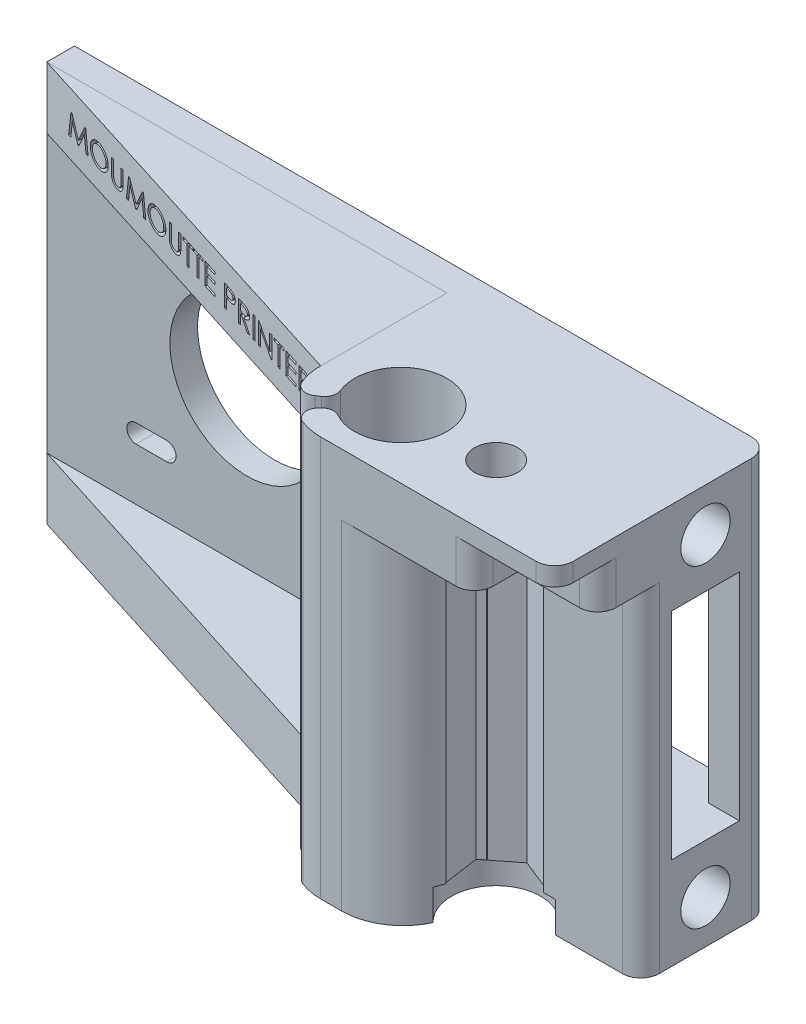
from build123d import *

# Parameters (mm, degrees)
SKETCH1_W           = 48
SKETCH1_H           = 35
BOSS_EXTRUDE1_DEPTH = 65
SKETCH2_R           = 7.5
SKETCH2_R_2         = 3.5
CUT_EXTRUDE1_DEPTH  = 89.056799851
SKETCH3_W           = 14
SKETCH3_H           = 55
CUT_EXTRUDE2_DEPTH  = 25
SKETCH4_W           = 11
SKETCH4_H           = 35
CUT_EXTRUDE3_DEPTH  = 89.056799851
SKETCH7_R           = 4
CUT_EXTRUDE4_DEPTH  = 28.5
SKETCH8_W           = 38
SKETCH8_H           = 35
CUT_EXTRUDE5_DEPTH  = 10
SKETCH9_W           = 7
SKETCH9_H           = 7
CUT_EXTRUDE7_DEPTH  = 13
FILLET2_R           = 3
CUT_EXTRUDE8_DEPTH  = 60
SKETCH11_R          = 7.25
CUT_EXTRUDE9_DEPTH  = 5
FILLET3_R           = 10
CUT_EXTRUDE11_DEPTH = 89.056799851
FILLET4_R           = 2
SKETCH14_W          = 65
SKETCH14_H          = 65
BOSS_EXTRUDE2_DEPTH = 4.5
BOSS_EXTRUDE3_DEPTH = 10
BOSS_EXTRUDE4_DEPTH = 10
SKETCH17_R          = 12.5
CUT_EXTRUDE12_DEPTH = 97.851690744
SKETCH18_W          = 0.538461539
SKETCH18_H          = 3.5
CUT_EXTRUDE13_DEPTH = 2


with BuildPart() as part:
    # Sketch1 → Boss-Extrude1 (new body)
    with BuildSketch(Plane(origin=(0, 0, 0), x_dir=(1, 0, 0), z_dir=(0, 1, 0))):
        with Locations((24, 17.5)):
            Rectangle(SKETCH1_W, SKETCH1_H)
    extrude(amount=BOSS_EXTRUDE1_DEPTH)

    # Sketch2 → Cut-Extrude1 (cut, through all)
    with BuildSketch(Plane(origin=(0, 65, 0), x_dir=(1, 0, 0), z_dir=(0, 1, 0))):
        with Locations(Location((12, 11, 0), (0, 0, 270))):
            Circle(SKETCH2_R)
        with Locations(Location((27.5, 11, 0), (0, 0, 270))):
            Circle(SKETCH2_R_2)
    extrude(amount=-CUT_EXTRUDE1_DEPTH, mode=Mode.SUBTRACT)

    # Sketch3 → Cut-Extrude2 (cut)
    with BuildSketch(Plane(origin=(48, 0, 0), x_dir=(0, 0, -1), z_dir=(1, 0, 0))):
        with Locations((7, 27.5)):
            Rectangle(SKETCH3_W, SKETCH3_H)
    extrude(amount=-CUT_EXTRUDE2_DEPTH, mode=Mode.SUBTRACT)

    # Sketch4 → Cut-Extrude3 (cut, through all)
    with BuildSketch(Plane(origin=(48, 0, 0), x_dir=(0, 0, -1), z_dir=(1, 0, 0))):
        with Locations((24.5, 32.5)):
            Rectangle(SKETCH4_W, SKETCH4_H)
    extrude(amount=-CUT_EXTRUDE3_DEPTH, mode=Mode.SUBTRACT)

    # Sketch7 → Cut-Extrude4 (cut)
    with BuildSketch(Plane(origin=(48, 0, 0), x_dir=(0, 0, -1), z_dir=(1, 0, 0))):
        with Locations((24.5, 58)):
            Circle(SKETCH7_R)
        with Locations((24.5, 7)):
            Circle(SKETCH7_R)
    extrude(amount=-CUT_EXTRUDE4_DEPTH, mode=Mode.SUBTRACT)

    # Sketch8 → Cut-Extrude5 (cut)
    with BuildSketch(Plane(origin=(0, 0, -35), x_dir=(-1, 0, 0), z_dir=(0, 0, -1))):
        with Locations((-24, 32.5)):
            Rectangle(SKETCH8_W, SKETCH8_H)
    extrude(amount=-CUT_EXTRUDE5_DEPTH, mode=Mode.SUBTRACT)

    # Sketch9 → Cut-Extrude7 (cut)
    with BuildSketch(Plane(origin=(48, 0, 0), x_dir=(0, 0, -1), z_dir=(1, 0, 0))):
        with Locations((3.5, 58.5)):
            Rectangle(SKETCH9_W, SKETCH9_H)
    extrude(amount=-CUT_EXTRUDE7_DEPTH, mode=Mode.SUBTRACT)

    # Fillet2
    fillet2_edges = [part.edges().sort_by_distance(p)[0] for p in [
        (48, 27.5, -14),
        (48, 32.5, -35),
        (48, 63.5, 0),
        (35, 58.5, 0),
        (48, 58.5, -7),
    ]]
    fillet(fillet2_edges, radius=FILLET2_R)

    # Sketch10 → Cut-Extrude8 (cut)
    with BuildSketch(Plane.XZ):
        Polygon((26.670780077, -16.830299677), (32.13457767, -14.633275357), (32.963797593, -8.802975681), (28.329219923, -5.169700323), (22.86542233, -7.366724643), (22.036202407, -13.197024319), align=None)
    extrude(amount=-CUT_EXTRUDE8_DEPTH, mode=Mode.SUBTRACT)

    # Sketch11 → Cut-Extrude9 (cut)
    with BuildSketch(Plane.XZ):
        with Locations((27.5, -11)):
            Circle(SKETCH11_R)
    extrude(amount=-CUT_EXTRUDE9_DEPTH, mode=Mode.SUBTRACT)

    # Fillet3
    # the kernel refuses this fillet: 10 mm, written as the material it takes off along each edge
    with BuildSketch(Plane(origin=(23, 55, 0), x_dir=(-1, 0, 0), z_dir=(0, -1, 0))) as fillet3_piece_1:
        with BuildLine():
            CenterArc((9.632130398, 10), FILLET3_R, 195.589242649, 74.410757351)
            Line((0, 7.312610191), (0, 0))
            Line((0, 0), (9.632130398, 0))
        make_face()
    extrude(amount=79.080325996, mode=Mode.SUBTRACT)
    with BuildSketch(Plane(origin=(0, -25, 0), x_dir=(1, 0, 0), z_dir=(0, 1, 0))) as fillet3_piece_2:
        with BuildLine():
            CenterArc((FILLET3_R, FILLET3_R), FILLET3_R, 180, 90)
            Line((0, FILLET3_R), (0, 0))
            Line((0, 0), (FILLET3_R, 0))
        make_face()
    extrude(amount=115, mode=Mode.SUBTRACT)

    # Sketch12 → Cut-Extrude11 (cut, through all)
    with BuildSketch(Plane(origin=(0, 65, 0), x_dir=(1, 0, 0), z_dir=(0, 1, 0))):
        Polygon((1.920028593, 4.108135943), (5.808776546, 6.766945295), (7.035358354, 5.378404734), (4.031188353, 1.976703451), (3.841374382, 1.711176179), (1.682221606, 3.870328955), align=None)
    extrude(amount=-CUT_EXTRUDE11_DEPTH, mode=Mode.SUBTRACT)

    # Fillet4
    fillet4_edges = [part.edges().sort_by_distance(p)[0] for p in [
        (1.920028593, 32.5, -4.108135943),
        (5.808776546, 32.5, -6.766945295),
        (7.035358354, 32.5, -5.378404734),
        (4.031188353, 32.5, -1.976703451),
    ]]
    fillet(fillet4_edges, radius=FILLET4_R)

    # Sketch14 → Boss-Extrude2 (add)
    with BuildSketch(Plane(origin=(0, 0, -35), x_dir=(-1, 0, 0), z_dir=(0, 0, -1))):
        with Locations((32.5, 32.5)):
            Rectangle(SKETCH14_W, SKETCH14_H)
    extrude(amount=-BOSS_EXTRUDE2_DEPTH)

    # Sketch16 → Boss-Extrude4 (add)
    with BuildSketch(Plane.XZ):
        Polygon((-65, -30.5), (0, -30.5), (0, -10), align=None)
    extrude(amount=-BOSS_EXTRUDE4_DEPTH)

    # Sketch17 → Cut-Extrude12 (cut, through all)
    with BuildSketch(Plane.XY.offset(-30.5)):
        with Locations((-32.5, 35.5)):
            Circle(SKETCH17_R)
        with BuildLine():
            Line((-45.5, 18.5), (-50.5, 18.5))
            ThreePointArc((-50.5, 18.5), (-52, 20), (-50.5, 21.5))
            Line((-50.5, 21.5), (-45.5, 21.5))
            ThreePointArc((-45.5, 21.5), (-44, 20), (-45.5, 18.5))
        make_face()
        with BuildLine():
            Line((-19.5, 21.5), (-14.5, 21.5))
            ThreePointArc((-14.5, 21.5), (-13, 20), (-14.5, 18.5))
            Line((-14.5, 18.5), (-19.5, 18.5))
            ThreePointArc((-19.5, 18.5), (-21, 20), (-19.5, 21.5))
        make_face()
        with BuildLine():
            Line((-50.5, 52.5), (-45.5, 52.5))
            ThreePointArc((-45.5, 52.5), (-44, 51), (-45.5, 49.5))
            Line((-45.5, 49.5), (-50.5, 49.5))
            ThreePointArc((-50.5, 49.5), (-52, 51), (-50.5, 52.5))
        make_face()
        with BuildLine():
            Line((-19.5, 52.5), (-14.5, 52.5))
            ThreePointArc((-14.5, 52.5), (-13, 51), (-14.5, 49.5))
            Line((-14.5, 49.5), (-19.5, 49.5))
            ThreePointArc((-19.5, 49.5), (-21, 51), (-19.5, 52.5))
        make_face()
    extrude(amount=-CUT_EXTRUDE12_DEPTH, mode=Mode.SUBTRACT)


with BuildPart() as body_2:
    # Sketch15 → Boss-Extrude3 (new body)
    with BuildSketch(Plane(origin=(0, 65, 0), x_dir=(1, 0, 0), z_dir=(0, 1, 0))):
        Polygon((-65, 30.5), (0, 30.5), (0, 10), align=None)
    extrude(amount=-BOSS_EXTRUDE3_DEPTH)


with BuildPart() as cut_extrude13_tool:
    # Sketch18 → Cut-Extrude13 (new body)
    # profile 1 of 16: a face of its own
    with BuildSketch(Plane(origin=(2.868521608, 0, -9.095312416), x_dir=(0.9536934736019076, 0, 0.30078024936675557), z_dir=(-0.30078024936675557, 0, 0.9536934736019077))):
        Polygon((-65.726154412, 58.198968083), (-65.135809861, 61.698968083), (-64.899531816, 61.698968083), (-63.306583098, 58.916916801), (-61.710128771, 61.698968083), (-61.473149604, 61.698968083), (-60.880000566, 58.198968083), (-61.414255373, 58.198968083), (-61.81529704, 60.666916801), (-63.191599123, 58.198968083), (-63.425072681, 58.198968083), (-64.793662425, 60.666916801), (-65.191899604, 58.198968083), align=None)
    # profile 2 of 16: a face of its own
    with BuildSketch(Plane(origin=(2.868521608, 0, -9.095312416), x_dir=(0.9536934736019076, 0, 0.30078024936675557), z_dir=(-0.30078024936675557, 0, 0.9536934736019077))):
        with BuildLine():
            add(Edge.make_bspline(
                [(-58.169463707, 61.788711673), (-58.089934817, 61.78716073), (-57.933968302, 61.784119127), (-57.705353455, 61.7583297), (-57.486808458, 61.716341772), (-57.278241026, 61.657892355), (-57.080061879, 61.581278857), (-56.891235409, 61.489780641), (-56.713205796, 61.379749349), (-56.57459257, 61.2744545), (-56.469912965, 61.184078711), (-56.39644048, 61.113893038), (-56.327574709, 61.042596816), (-56.264181873, 60.969313307), (-56.205834576, 60.894233368), (-56.152664688, 60.817099632), (-56.103995503, 60.738361195), (-56.060514372, 60.657906907), (-56.022496534, 60.575416402), (-55.989685223, 60.491308787), (-55.961246763, 60.405562086), (-55.939039984, 60.317842183), (-55.921703601, 60.228377948), (-55.907758259, 60.137482301), (-55.901252107, 60.04441578), (-55.899909412, 59.981927621), (-55.899231335, 59.950370327)],
                knots=[0, 0, 0, 0, 1.762200569, 3.455904906, 5.091416672, 6.69013804, 8.249439564, 9.794567683, 11.334129321, 12.879769591, 13.64722479, 14.398283861, 15.130953058, 15.843347867, 16.544774219, 17.237308484, 17.918692428, 18.595414175, 19.262874619, 19.930415452, 20.595439571, 21.263783751, 21.934232136, 22.614749279, 23.300431227, 24, 24, 24, 24], degree=3))
            add(Edge.make_bspline(
                [(-55.899231335, 59.950370327), (-55.899890586, 59.919043206), (-55.901200819, 59.856781885), (-55.908013562, 59.764266302), (-55.920610952, 59.673382682), (-55.939229592, 59.584611366), (-55.961260221, 59.497053062), (-55.989724062, 59.411871786), (-56.021791728, 59.327806546), (-56.05980232, 59.245622421), (-56.103416054, 59.165404576), (-56.151116824, 59.086209314), (-56.204688022, 59.009265745), (-56.262728235, 58.933509564), (-56.325959635, 58.859814039), (-56.394312724, 58.788241252), (-56.467354173, 58.717862133), (-56.571490079, 58.626946452), (-56.709465775, 58.521439531), (-56.885363759, 58.410396769), (-57.071418664, 58.318291538), (-57.265900002, 58.240632955), (-57.470532518, 58.182652809), (-57.683957631, 58.139388159), (-57.906858788, 58.113929178), (-58.058621693, 58.110810623), (-58.135809861, 58.109224494)],
                knots=[0, 0, 0, 0, 0.701042721, 1.393292621, 2.074411961, 2.752311811, 3.42199316, 4.093387355, 4.760552673, 5.434406531, 6.117610403, 6.802792697, 7.501960551, 8.214244819, 8.937425809, 9.673499676, 10.427974789, 11.206214768, 12.765661073, 14.309412897, 15.852907847, 17.404680958, 18.98854736, 20.604825758, 22.273179616, 24, 24, 24, 24], degree=3))
            add(Edge.make_bspline(
                [(-58.135809861, 58.109224494), (-58.211593279, 58.11086639), (-58.360528471, 58.114093166), (-58.579450133, 58.13875666), (-58.789244503, 58.181079995), (-58.990317723, 58.239244648), (-59.182916409, 58.313438796), (-59.365654691, 58.405974193), (-59.539809353, 58.514515314), (-59.676454529, 58.617859269), (-59.779276503, 58.707802375), (-59.852054606, 58.776789354), (-59.919724091, 58.847900297), (-59.982015332, 58.920837438), (-60.039814743, 58.995306166), (-60.09244647, 59.071508031), (-60.13941591, 59.150001282), (-60.182673776, 59.229610869), (-60.219286711, 59.312037442), (-60.252765419, 59.395225406), (-60.279995023, 59.480603309), (-60.302535571, 59.567669454), (-60.319901882, 59.656656827), (-60.332828605, 59.747424287), (-60.339551203, 59.839958817), (-60.340873637, 59.902217573), (-60.341539027, 59.933543404)],
                knots=[0, 0, 0, 0, 1.714843705, 3.370138006, 4.977920342, 6.553016067, 8.101964335, 9.641819603, 11.181347831, 12.740592413, 13.512801172, 14.272243157, 15.009252397, 15.733241277, 16.44205976, 17.141862002, 17.827611856, 18.511462151, 19.19081831, 19.86753394, 20.539936593, 21.21727202, 21.901878686, 22.590782833, 23.290944758, 24, 24, 24, 24], degree=3))
            add(Edge.make_bspline(
                [(-60.341539027, 59.933543404), (-60.340480085, 59.9754067), (-60.338380575, 60.058406874), (-60.325085909, 60.181812747), (-60.301442537, 60.302562822), (-60.270235559, 60.42162634), (-60.228656699, 60.538066063), (-60.177655249, 60.65187097), (-60.119065868, 60.763917943), (-60.049917496, 60.872038149), (-59.974179681, 60.976753174), (-59.891036708, 61.076121365), (-59.801070661, 61.169330776), (-59.705007909, 61.257141598), (-59.602305194, 61.338866562), (-59.492538964, 61.413723061), (-59.376629337, 61.483194167), (-59.255044393, 61.546978644), (-59.128354347, 61.603221125), (-58.998963886, 61.653417315), (-58.866434104, 61.694531469), (-58.73195234, 61.729060675), (-58.594769555, 61.755856966), (-58.455201336, 61.774302166), (-58.313199144, 61.78713493), (-58.217636306, 61.788183231), (-58.169463707, 61.788711673)],
                knots=[0, 0, 0, 0, 0.950009716, 1.883534703, 2.812332798, 3.73981275, 4.674105667, 5.614265215, 6.567924084, 7.54044772, 8.523784856, 9.49885006, 10.477772706, 11.461295732, 12.450208591, 13.453422857, 14.473884269, 15.515229677, 16.566854886, 17.617730997, 18.662689203, 19.713551933, 20.767140987, 21.83215985, 22.907206011, 24, 24, 24, 24], degree=3))
        make_face()
        with BuildLine():
            add(Edge.make_bspline(
                [(-58.15123454, 61.384865519), (-58.186780138, 61.384400131), (-58.257522935, 61.383473917), (-58.362818275, 61.373756502), (-58.466841043, 61.359426483), (-58.569500721, 61.337989482), (-58.671096387, 61.311436087), (-58.771654377, 61.279269273), (-58.870821182, 61.240393528), (-58.968213646, 61.19594419), (-59.062305584, 61.146162556), (-59.152588794, 61.093321304), (-59.236749277, 61.034647818), (-59.316140958, 60.972438741), (-59.390260991, 60.905503207), (-59.458586502, 60.833818791), (-59.52312304, 60.758841232), (-59.580846366, 60.678726177), (-59.633604308, 60.596005019), (-59.678621787, 60.509501099), (-59.717392839, 60.420894724), (-59.748182807, 60.328785631), (-59.772798005, 60.234417203), (-59.790340131, 60.136925662), (-59.801085153, 60.036851418), (-59.802409871, 59.969093528), (-59.803077489, 59.934945647)],
                knots=[0, 0, 0, 0, 1.046875013, 2.083489087, 3.11266852, 4.138872874, 5.17090399, 6.20513746, 7.247156243, 8.306991688, 9.357166944, 10.382077102, 11.386643276, 12.376976079, 13.351871674, 14.325745646, 15.292830233, 16.263706125, 17.232162187, 18.180687714, 19.133551147, 20.078471624, 21.038669459, 22.004257903, 22.99420771, 24, 24, 24, 24], degree=3))
            add(Edge.make_bspline(
                [(-59.803077489, 59.934945647), (-59.801667147, 59.885068425), (-59.798890316, 59.786864891), (-59.774777267, 59.643025213), (-59.737229088, 59.505252089), (-59.683396769, 59.373979738), (-59.614442547, 59.249101637), (-59.529046494, 59.131547471), (-59.430016729, 59.019427528), (-59.316087812, 58.916151087), (-59.191963981, 58.822217445), (-59.060912859, 58.739059113), (-58.923437686, 58.669420061), (-58.780217577, 58.612499029), (-58.631411027, 58.567221445), (-58.47642733, 58.536114), (-58.315801905, 58.516517752), (-58.206680839, 58.514232051), (-58.15123454, 58.513070647)],
                knots=[0, 0, 0, 0, 0.98655117, 1.942425967, 2.878350584, 3.807748684, 4.743581856, 5.694789552, 6.677777585, 7.699276772, 8.732635428, 9.755421936, 10.766986664, 11.777958991, 12.802281883, 13.840968655, 14.902958868, 16, 16, 16, 16], degree=3))
            add(Edge.make_bspline(
                [(-58.15123454, 58.513070647), (-58.112184947, 58.513527248), (-58.034911017, 58.514430799), (-57.920272296, 58.524136132), (-57.807854964, 58.538477513), (-57.697892276, 58.559676846), (-57.590253861, 58.586414007), (-57.48478775, 58.618556378), (-57.381549977, 58.657237882), (-57.281180409, 58.701877124), (-57.184643529, 58.751722631), (-57.092492749, 58.805106512), (-57.007089113, 58.864782387), (-56.925792128, 58.926812664), (-56.850866833, 58.994401276), (-56.7812041, 59.065995888), (-56.717280667, 59.141935654), (-56.658997446, 59.221725096), (-56.607487904, 59.305184091), (-56.561336819, 59.390486055), (-56.523844211, 59.478783348), (-56.491507643, 59.568632084), (-56.468353278, 59.661326626), (-56.450393266, 59.755833302), (-56.439699326, 59.85266792), (-56.438365306, 59.918092955), (-56.437692873, 59.951071449)],
                knots=[0, 0, 0, 0, 1.128570446, 2.233290198, 3.323516081, 4.40339388, 5.468461225, 6.528438126, 7.5888025, 8.653419776, 9.701901791, 10.728497928, 11.729202701, 12.711633058, 13.682825658, 14.643148119, 15.597271811, 16.54995929, 17.496687307, 18.430600778, 19.350529623, 20.267177967, 21.188073814, 22.108994443, 23.046809601, 24, 24, 24, 24], degree=3))
            add(Edge.make_bspline(
                [(-56.437692873, 59.951071449), (-56.438363548, 59.983816881), (-56.439694027, 60.048777014), (-56.450412581, 60.144906212), (-56.468239009, 60.238515061), (-56.491663253, 60.330204449), (-56.523684363, 60.418993893), (-56.561374788, 60.506061622), (-56.607496526, 60.589967936), (-56.659022831, 60.672021756), (-56.717476904, 60.75069927), (-56.781957919, 60.825624162), (-56.852230493, 60.896628982), (-56.928387773, 60.963296736), (-57.009696897, 61.026512556), (-57.096989048, 61.085640339), (-57.190345679, 61.14015424), (-57.288746646, 61.190295935), (-57.39060696, 61.235553674), (-57.494374327, 61.275726118), (-57.599923068, 61.309601611), (-57.707272994, 61.336637902), (-57.816011415, 61.358677358), (-57.92629153, 61.373951111), (-58.038184588, 61.383442496), (-58.113354963, 61.384388708), (-58.15123454, 61.384865519)],
                knots=[0, 0, 0, 0, 0.949985702, 1.884574245, 2.802280815, 3.713500324, 4.627189335, 5.538131236, 6.463597041, 7.402383135, 8.347710351, 9.304641261, 10.268467334, 11.243865615, 12.239491831, 13.255146885, 14.300719576, 15.374328445, 16.458083621, 17.53357549, 18.601580026, 19.672293765, 20.744209396, 21.8192736, 22.901096398, 24, 24, 24, 24], degree=3))
        make_face(mode=Mode.SUBTRACT)
    # profile 3 of 16: a face of its own
    with BuildSketch(Plane(origin=(2.868521608, 0, -9.095312416), x_dir=(0.9536934736019076, 0, 0.30078024936675557), z_dir=(-0.30078024936675557, 0, 0.9536934736019077))):
        with BuildLine():
            Line((-55.046667232, 61.698968083), (-54.508205694, 61.698968083))
            Line((-54.508205694, 61.698968083), (-54.508205694, 59.585786994))
            add(Edge.make_bspline(
                [(-54.508205694, 59.585786994), (-54.508252376, 59.556106214), (-54.508340964, 59.49978182), (-54.507752682, 59.420081401), (-54.506122971, 59.349741392), (-54.504952201, 59.288733434), (-54.503038857, 59.236821983), (-54.499981759, 59.194321208), (-54.497774164, 59.161021879), (-54.494754758, 59.142198324), (-54.493482136, 59.134264558)],
                knots=[0, 0, 0, 0, 1.575744092, 2.990245961, 4.231237464, 5.310969395, 6.229873692, 6.988352612, 7.573610094, 8, 8, 8, 8], degree=3))
            add(Edge.make_bspline(
                [(-54.493482136, 59.134264558), (-54.487608192, 59.101550744), (-54.476265861, 59.038381796), (-54.445159798, 58.950480572), (-54.407829028, 58.871187651), (-54.359190118, 58.801533217), (-54.298158311, 58.740736116), (-54.225137063, 58.685618821), (-54.138076222, 58.637240763), (-54.040506023, 58.593811694), (-53.93621653, 58.557704651), (-53.82870789, 58.533042118), (-53.721418698, 58.515512248), (-53.649400859, 58.513881762), (-53.613574284, 58.513070647)],
                knots=[0, 0, 0, 0, 1.010939578, 1.952080289, 2.830916875, 3.674316992, 4.525137018, 5.445005188, 6.452604883, 7.552123497, 8.695885249, 9.808009491, 10.909554699, 12, 12, 12, 12], degree=3))
            add(Edge.make_bspline(
                [(-53.613574284, 58.513070647), (-53.580586583, 58.51389106), (-53.515069003, 58.515520498), (-53.418019522, 58.528213514), (-53.323909568, 58.550421646), (-53.232745307, 58.579243688), (-53.147062522, 58.617221617), (-53.067449246, 58.661171373), (-52.995142412, 58.712051729), (-52.930477491, 58.769700417), (-52.873213677, 58.833704879), (-52.824576143, 58.904409814), (-52.784240144, 58.981257102), (-52.764152418, 59.035854629), (-52.753998963, 59.063451256)],
                knots=[0, 0, 0, 0, 1.08678465, 2.158486357, 3.217636834, 4.269680818, 5.304131945, 6.300416313, 7.261866377, 8.210900501, 9.149062306, 10.084660606, 11.031880909, 12, 12, 12, 12], degree=3))
            add(Edge.make_bspline(
                [(-52.753998963, 59.063451256), (-52.750465811, 59.075075779), (-52.742580907, 59.10101812), (-52.736033704, 59.145173), (-52.728793258, 59.197479352), (-52.722351376, 59.258479975), (-52.718576315, 59.328205983), (-52.715954606, 59.406519915), (-52.713635608, 59.493226007), (-52.713437508, 59.554001015), (-52.713333899, 59.585786994)],
                knots=[0, 0, 0, 0, 0.554359346, 1.237158672, 2.034405523, 2.968223321, 4.037799584, 5.223667208, 6.547948305, 8, 8, 8, 8], degree=3))
            Line((-52.713333899, 59.585786994), (-52.713333899, 61.698968083))
            Line((-52.713333899, 61.698968083), (-52.174872361, 61.698968083))
            Line((-52.174872361, 61.698968083), (-52.174872361, 59.592798211))
            add(Edge.make_bspline(
                [(-52.174872361, 59.592798211), (-52.174980155, 59.555627609), (-52.175190454, 59.483109911), (-52.181517734, 59.377000837), (-52.189066599, 59.276074552), (-52.202430793, 59.180328562), (-52.216939531, 59.089303213), (-52.237229141, 59.003666079), (-52.258943175, 58.922795495), (-52.286093171, 58.846952225), (-52.317506929, 58.774160507), (-52.357272684, 58.704729033), (-52.403736533, 58.637223497), (-52.457272018, 58.571634903), (-52.518846774, 58.508498177), (-52.587300971, 58.446908245), (-52.663612658, 58.387871754), (-52.746438454, 58.33159289), (-52.834907832, 58.278826774), (-52.928926517, 58.233231415), (-53.028061775, 58.195336777), (-53.131591324, 58.163833629), (-53.239861245, 58.139333954), (-53.352760251, 58.121842897), (-53.470338577, 58.111174415), (-53.550450777, 58.109881263), (-53.591138386, 58.109224494)],
                knots=[0, 0, 0, 0, 1.140858855, 2.225749692, 3.26247974, 4.246740674, 5.192706169, 6.090770029, 6.947201528, 7.761863473, 8.56173186, 9.377782721, 10.213621207, 11.075325684, 11.973418203, 12.918403705, 13.900046223, 14.932846327, 15.991051794, 17.059592323, 18.136171706, 19.246017686, 20.379089327, 21.540961063, 22.751096395, 24, 24, 24, 24], degree=3))
            add(Edge.make_bspline(
                [(-53.591138386, 58.109224494), (-53.633219013, 58.110006879), (-53.715842186, 58.111543054), (-53.83740162, 58.120390233), (-53.954423723, 58.136720595), (-54.066961261, 58.159188818), (-54.175438523, 58.186759018), (-54.278830269, 58.222213195), (-54.377950945, 58.263580371), (-54.472276587, 58.310915283), (-54.560347856, 58.363996332), (-54.641382312, 58.421744945), (-54.715286121, 58.483336002), (-54.781526026, 58.54945422), (-54.840031581, 58.619834936), (-54.89095983, 58.694607832), (-54.933832684, 58.77396568), (-54.956701248, 58.829526376), (-54.968141591, 58.857321449)],
                knots=[0, 0, 0, 0, 1.212046674, 2.37979209, 3.507811482, 4.612699963, 5.683668952, 6.72879567, 7.757603739, 8.775053445, 9.765493878, 10.716186048, 11.638332541, 12.533124769, 13.407869469, 14.270383023, 15.134733109, 16, 16, 16, 16], degree=3))
            add(Edge.make_bspline(
                [(-54.968141591, 58.857321449), (-54.974496216, 58.876168783), (-54.988152193, 58.916671372), (-55.00393809, 58.983756299), (-55.016757207, 59.060867786), (-55.028106338, 59.147840099), (-55.036060354, 59.244950018), (-55.04251607, 59.352003969), (-55.045724484, 59.469147963), (-55.046344706, 59.550495828), (-55.046667232, 59.592798211)],
                knots=[0, 0, 0, 0, 0.642440093, 1.380592379, 2.223596695, 3.167789362, 4.213877325, 5.371307655, 6.633031722, 8, 8, 8, 8], degree=3))
            Line((-55.046667232, 59.592798211), (-55.046667232, 61.698968083))
        make_face()
    # profile 4 of 16: a face of its own
    with BuildSketch(Plane(origin=(2.868521608, 0, -9.095312416), x_dir=(0.9536934736019076, 0, 0.30078024936675557), z_dir=(-0.30078024936675557, 0, 0.9536934736019077))):
        Polygon((-51.367180053, 58.198968083), (-50.776835502, 61.698968083), (-50.540557457, 61.698968083), (-48.947608739, 58.916916801), (-47.351154412, 61.698968083), (-47.114175245, 61.698968083), (-46.521026207, 58.198968083), (-47.055281014, 58.198968083), (-47.456322681, 60.666916801), (-48.832624764, 58.198968083), (-49.066098322, 58.198968083), (-50.434688066, 60.666916801), (-50.832925245, 58.198968083), align=None)
    # profile 5 of 16: a face of its own
    with BuildSketch(Plane(origin=(2.868521608, 0, -9.095312416), x_dir=(0.9536934736019076, 0, 0.30078024936675557), z_dir=(-0.30078024936675557, 0, 0.9536934736019077))):
        with BuildLine():
            add(Edge.make_bspline(
                [(-43.810489348, 61.788711673), (-43.730960458, 61.78716073), (-43.574993943, 61.784119127), (-43.346379096, 61.7583297), (-43.127834099, 61.716341772), (-42.919266667, 61.657892355), (-42.72108752, 61.581278857), (-42.53226105, 61.489780641), (-42.354231437, 61.379749349), (-42.215618211, 61.2744545), (-42.110938606, 61.184078711), (-42.037466121, 61.113893038), (-41.96860035, 61.042596816), (-41.905207514, 60.969313307), (-41.846860217, 60.894233368), (-41.793690329, 60.817099632), (-41.745021144, 60.738361195), (-41.701540013, 60.657906907), (-41.663522175, 60.575416402), (-41.630710864, 60.491308787), (-41.602272404, 60.405562086), (-41.580065625, 60.317842183), (-41.562729242, 60.228377948), (-41.5487839, 60.137482301), (-41.542277748, 60.04441578), (-41.540935053, 59.981927621), (-41.540256976, 59.950370327)],
                knots=[0, 0, 0, 0, 1.762200569, 3.455904906, 5.091416672, 6.69013804, 8.249439564, 9.794567683, 11.334129321, 12.879769591, 13.64722479, 14.398283861, 15.130953058, 15.843347867, 16.544774219, 17.237308484, 17.918692428, 18.595414175, 19.262874619, 19.930415452, 20.595439571, 21.263783751, 21.934232136, 22.614749279, 23.300431227, 24, 24, 24, 24], degree=3))
            add(Edge.make_bspline(
                [(-41.540256976, 59.950370327), (-41.540916227, 59.919043206), (-41.54222646, 59.856781885), (-41.549039203, 59.764266302), (-41.561636593, 59.673382682), (-41.580255233, 59.584611366), (-41.602285862, 59.497053062), (-41.630749703, 59.411871786), (-41.662817369, 59.327806546), (-41.700827961, 59.245622421), (-41.744441695, 59.165404576), (-41.792142465, 59.086209314), (-41.845713663, 59.009265745), (-41.903753876, 58.933509564), (-41.966985276, 58.859814039), (-42.035338365, 58.788241252), (-42.108379814, 58.717862133), (-42.21251572, 58.626946452), (-42.350491416, 58.521439531), (-42.5263894, 58.410396769), (-42.712444305, 58.318291538), (-42.906925643, 58.240632955), (-43.111558159, 58.182652809), (-43.324983272, 58.139388159), (-43.547884429, 58.113929178), (-43.699647334, 58.110810623), (-43.776835502, 58.109224494)],
                knots=[0, 0, 0, 0, 0.701042721, 1.393292621, 2.074411961, 2.752311811, 3.42199316, 4.093387355, 4.760552673, 5.434406531, 6.117610403, 6.802792697, 7.501960551, 8.214244819, 8.937425809, 9.673499676, 10.427974789, 11.206214768, 12.765661073, 14.309412897, 15.852907847, 17.404680958, 18.98854736, 20.604825758, 22.273179616, 24, 24, 24, 24], degree=3))
            add(Edge.make_bspline(
                [(-43.776835502, 58.109224494), (-43.85261892, 58.11086639), (-44.001554112, 58.114093166), (-44.220475774, 58.13875666), (-44.430270144, 58.181079995), (-44.631343364, 58.239244648), (-44.82394205, 58.313438796), (-45.006680332, 58.405974193), (-45.180834994, 58.514515314), (-45.31748017, 58.617859269), (-45.420302144, 58.707802375), (-45.493080247, 58.776789354), (-45.560749732, 58.847900297), (-45.623040973, 58.920837438), (-45.680840384, 58.995306166), (-45.733472111, 59.071508031), (-45.780441551, 59.150001282), (-45.823699417, 59.229610869), (-45.860312352, 59.312037442), (-45.893791061, 59.395225406), (-45.921020664, 59.480603309), (-45.943561212, 59.567669454), (-45.960927523, 59.656656827), (-45.973854246, 59.747424287), (-45.980576844, 59.839958817), (-45.981899278, 59.902217573), (-45.982564668, 59.933543404)],
                knots=[0, 0, 0, 0, 1.714843705, 3.370138006, 4.977920342, 6.553016067, 8.101964335, 9.641819603, 11.181347831, 12.740592413, 13.512801172, 14.272243157, 15.009252397, 15.733241277, 16.44205976, 17.141862002, 17.827611856, 18.511462151, 19.19081831, 19.86753394, 20.539936593, 21.21727202, 21.901878686, 22.590782833, 23.290944758, 24, 24, 24, 24], degree=3))
            add(Edge.make_bspline(
                [(-45.982564668, 59.933543404), (-45.981505726, 59.9754067), (-45.979406216, 60.058406874), (-45.96611155, 60.181812747), (-45.942468178, 60.302562822), (-45.9112612, 60.42162634), (-45.86968234, 60.538066063), (-45.81868089, 60.65187097), (-45.760091509, 60.763917943), (-45.690943137, 60.872038149), (-45.615205322, 60.976753174), (-45.532062349, 61.076121365), (-45.442096302, 61.169330776), (-45.34603355, 61.257141598), (-45.243330835, 61.338866562), (-45.133564605, 61.413723061), (-45.017654978, 61.483194167), (-44.896070034, 61.546978644), (-44.769379988, 61.603221125), (-44.639989527, 61.653417315), (-44.507459745, 61.694531469), (-44.372977981, 61.729060675), (-44.235795196, 61.755856966), (-44.096226978, 61.774302166), (-43.954224785, 61.78713493), (-43.858661947, 61.788183231), (-43.810489348, 61.788711673)],
                knots=[0, 0, 0, 0, 0.950009716, 1.883534703, 2.812332798, 3.73981275, 4.674105667, 5.614265215, 6.567924084, 7.54044772, 8.523784856, 9.49885006, 10.477772706, 11.461295732, 12.450208591, 13.453422857, 14.473884269, 15.515229677, 16.566854886, 17.617730997, 18.662689203, 19.713551933, 20.767140987, 21.83215985, 22.907206011, 24, 24, 24, 24], degree=3))
        make_face()
        with BuildLine():
            add(Edge.make_bspline(
                [(-43.792260181, 61.384865519), (-43.827805779, 61.384400131), (-43.898548576, 61.383473917), (-44.003843916, 61.373756502), (-44.107866684, 61.359426483), (-44.210526362, 61.337989482), (-44.312122028, 61.311436087), (-44.412680018, 61.279269273), (-44.511846823, 61.240393528), (-44.609239287, 61.19594419), (-44.703331225, 61.146162556), (-44.793614435, 61.093321304), (-44.877774919, 61.034647818), (-44.957166599, 60.972438741), (-45.031286632, 60.905503207), (-45.099612143, 60.833818791), (-45.164148681, 60.758841232), (-45.221872007, 60.678726177), (-45.274629949, 60.596005019), (-45.319647428, 60.509501099), (-45.35841848, 60.420894724), (-45.389208449, 60.328785631), (-45.413823646, 60.234417203), (-45.431365772, 60.136925662), (-45.442110794, 60.036851418), (-45.443435512, 59.969093528), (-45.44410313, 59.934945647)],
                knots=[0, 0, 0, 0, 1.046875013, 2.083489087, 3.11266852, 4.138872874, 5.17090399, 6.20513746, 7.247156243, 8.306991688, 9.357166944, 10.382077102, 11.386643276, 12.376976079, 13.351871674, 14.325745646, 15.292830233, 16.263706125, 17.232162187, 18.180687714, 19.133551147, 20.078471624, 21.038669459, 22.004257903, 22.99420771, 24, 24, 24, 24], degree=3))
            add(Edge.make_bspline(
                [(-45.44410313, 59.934945647), (-45.442692788, 59.885068425), (-45.439915957, 59.786864891), (-45.415802908, 59.643025213), (-45.378254729, 59.505252089), (-45.32442241, 59.373979738), (-45.255468188, 59.249101637), (-45.170072135, 59.131547471), (-45.07104237, 59.019427528), (-44.957113453, 58.916151087), (-44.832989622, 58.822217445), (-44.7019385, 58.739059113), (-44.564463327, 58.669420061), (-44.421243218, 58.612499029), (-44.272436668, 58.567221445), (-44.117452971, 58.536114), (-43.956827546, 58.516517752), (-43.84770648, 58.514232051), (-43.792260181, 58.513070647)],
                knots=[0, 0, 0, 0, 0.98655117, 1.942425967, 2.878350584, 3.807748684, 4.743581856, 5.694789552, 6.677777585, 7.699276772, 8.732635428, 9.755421936, 10.766986664, 11.777958991, 12.802281883, 13.840968655, 14.902958868, 16, 16, 16, 16], degree=3))
            add(Edge.make_bspline(
                [(-43.792260181, 58.513070647), (-43.753210588, 58.513527248), (-43.675936658, 58.514430799), (-43.561297937, 58.524136132), (-43.448880605, 58.538477513), (-43.338917917, 58.559676846), (-43.231279502, 58.586414007), (-43.125813391, 58.618556378), (-43.022575618, 58.657237882), (-42.92220605, 58.701877124), (-42.82566917, 58.751722631), (-42.73351839, 58.805106512), (-42.648114754, 58.864782387), (-42.566817769, 58.926812664), (-42.491892474, 58.994401276), (-42.422229742, 59.065995888), (-42.358306308, 59.141935654), (-42.300023087, 59.221725096), (-42.248513545, 59.305184091), (-42.20236246, 59.390486055), (-42.164869852, 59.478783348), (-42.132533284, 59.568632084), (-42.109378919, 59.661326626), (-42.091418908, 59.755833302), (-42.080724967, 59.85266792), (-42.079390947, 59.918092955), (-42.078718514, 59.951071449)],
                knots=[0, 0, 0, 0, 1.128570446, 2.233290198, 3.323516081, 4.40339388, 5.468461225, 6.528438126, 7.5888025, 8.653419776, 9.701901791, 10.728497928, 11.729202701, 12.711633058, 13.682825658, 14.643148119, 15.597271811, 16.54995929, 17.496687307, 18.430600778, 19.350529623, 20.267177967, 21.188073814, 22.108994443, 23.046809601, 24, 24, 24, 24], degree=3))
            add(Edge.make_bspline(
                [(-42.078718514, 59.951071449), (-42.079389189, 59.983816881), (-42.080719668, 60.048777014), (-42.091438222, 60.144906212), (-42.10926465, 60.238515061), (-42.132688894, 60.330204449), (-42.164710004, 60.418993893), (-42.202400429, 60.506061622), (-42.248522167, 60.589967936), (-42.300048472, 60.672021756), (-42.358502545, 60.75069927), (-42.42298356, 60.825624162), (-42.493256135, 60.896628982), (-42.569413414, 60.963296736), (-42.650722538, 61.026512556), (-42.738014689, 61.085640339), (-42.83137132, 61.14015424), (-42.929772287, 61.190295935), (-43.031632602, 61.235553674), (-43.135399968, 61.275726118), (-43.240948709, 61.309601611), (-43.348298635, 61.336637902), (-43.457037056, 61.358677358), (-43.567317171, 61.373951111), (-43.679210229, 61.383442496), (-43.754380604, 61.384388708), (-43.792260181, 61.384865519)],
                knots=[0, 0, 0, 0, 0.949985702, 1.884574245, 2.802280815, 3.713500324, 4.627189335, 5.538131236, 6.463597041, 7.402383135, 8.347710351, 9.304641261, 10.268467334, 11.243865615, 12.239491831, 13.255146885, 14.300719576, 15.374328445, 16.458083621, 17.53357549, 18.601580026, 19.672293765, 20.744209396, 21.8192736, 22.901096398, 24, 24, 24, 24], degree=3))
        make_face(mode=Mode.SUBTRACT)
    # profile 6 of 16: a face of its own
    with BuildSketch(Plane(origin=(2.868521608, 0, -9.095312416), x_dir=(0.9536934736019076, 0, 0.30078024936675557), z_dir=(-0.30078024936675557, 0, 0.9536934736019077))):
        with BuildLine():
            Line((-40.687692873, 61.698968083), (-40.149231335, 61.698968083))
            Line((-40.149231335, 61.698968083), (-40.149231335, 59.585786994))
            add(Edge.make_bspline(
                [(-40.149231335, 59.585786994), (-40.149278017, 59.556106214), (-40.149366605, 59.49978182), (-40.148778323, 59.420081401), (-40.147148612, 59.349741392), (-40.145977842, 59.288733434), (-40.144064498, 59.236821983), (-40.1410074, 59.194321208), (-40.138799805, 59.161021879), (-40.135780399, 59.142198324), (-40.134507777, 59.134264558)],
                knots=[0, 0, 0, 0, 1.575744092, 2.990245961, 4.231237464, 5.310969395, 6.229873692, 6.988352612, 7.573610094, 8, 8, 8, 8], degree=3))
            add(Edge.make_bspline(
                [(-40.134507777, 59.134264558), (-40.128633833, 59.101550744), (-40.117291502, 59.038381796), (-40.086185439, 58.950480572), (-40.048854669, 58.871187651), (-40.000215759, 58.801533217), (-39.939183952, 58.740736116), (-39.866162704, 58.685618821), (-39.779101863, 58.637240763), (-39.681531664, 58.593811694), (-39.577242171, 58.557704651), (-39.469733531, 58.533042118), (-39.362444339, 58.515512248), (-39.2904265, 58.513881762), (-39.254599925, 58.513070647)],
                knots=[0, 0, 0, 0, 1.010939578, 1.952080289, 2.830916875, 3.674316992, 4.525137018, 5.445005188, 6.452604883, 7.552123497, 8.695885249, 9.808009491, 10.909554699, 12, 12, 12, 12], degree=3))
            add(Edge.make_bspline(
                [(-39.254599925, 58.513070647), (-39.221612224, 58.51389106), (-39.156094644, 58.515520498), (-39.059045163, 58.528213514), (-38.964935209, 58.550421646), (-38.873770948, 58.579243688), (-38.788088163, 58.617221617), (-38.708474887, 58.661171373), (-38.636168053, 58.712051729), (-38.571503132, 58.769700417), (-38.514239318, 58.833704879), (-38.465601784, 58.904409814), (-38.425265785, 58.981257102), (-38.405178059, 59.035854629), (-38.395024604, 59.063451256)],
                knots=[0, 0, 0, 0, 1.08678465, 2.158486357, 3.217636834, 4.269680818, 5.304131945, 6.300416313, 7.261866377, 8.210900501, 9.149062306, 10.084660606, 11.031880909, 12, 12, 12, 12], degree=3))
            add(Edge.make_bspline(
                [(-38.395024604, 59.063451256), (-38.391491452, 59.075075779), (-38.383606548, 59.10101812), (-38.377059345, 59.145173), (-38.369818899, 59.197479352), (-38.363377017, 59.258479975), (-38.359601956, 59.328205983), (-38.356980247, 59.406519915), (-38.354661249, 59.493226007), (-38.354463149, 59.554001015), (-38.35435954, 59.585786994)],
                knots=[0, 0, 0, 0, 0.554359346, 1.237158672, 2.034405523, 2.968223321, 4.037799584, 5.223667208, 6.547948305, 8, 8, 8, 8], degree=3))
            Line((-38.35435954, 59.585786994), (-38.35435954, 61.698968083))
            Line((-38.35435954, 61.698968083), (-37.815898002, 61.698968083))
            Line((-37.815898002, 61.698968083), (-37.815898002, 59.592798211))
            add(Edge.make_bspline(
                [(-37.815898002, 59.592798211), (-37.816005796, 59.555627609), (-37.816216095, 59.483109911), (-37.822543375, 59.377000837), (-37.83009224, 59.276074552), (-37.843456434, 59.180328562), (-37.857965172, 59.089303213), (-37.878254782, 59.003666079), (-37.899968816, 58.922795495), (-37.927118813, 58.846952225), (-37.95853257, 58.774160507), (-37.998298325, 58.704729033), (-38.044762174, 58.637223497), (-38.098297659, 58.571634903), (-38.159872415, 58.508498177), (-38.228326612, 58.446908245), (-38.304638299, 58.387871754), (-38.387464095, 58.33159289), (-38.475933473, 58.278826774), (-38.569952158, 58.233231415), (-38.669087416, 58.195336777), (-38.772616965, 58.163833629), (-38.880886886, 58.139333954), (-38.993785892, 58.121842897), (-39.111364218, 58.111174415), (-39.191476418, 58.109881263), (-39.232164027, 58.109224494)],
                knots=[0, 0, 0, 0, 1.140858855, 2.225749692, 3.26247974, 4.246740674, 5.192706169, 6.090770029, 6.947201528, 7.761863473, 8.56173186, 9.377782721, 10.213621207, 11.075325684, 11.973418203, 12.918403705, 13.900046223, 14.932846327, 15.991051794, 17.059592323, 18.136171706, 19.246017686, 20.379089327, 21.540961063, 22.751096395, 24, 24, 24, 24], degree=3))
            add(Edge.make_bspline(
                [(-39.232164027, 58.109224494), (-39.274244654, 58.110006879), (-39.356867827, 58.111543054), (-39.478427262, 58.120390233), (-39.595449364, 58.136720595), (-39.707986902, 58.159188818), (-39.816464164, 58.186759018), (-39.91985591, 58.222213195), (-40.018976586, 58.263580371), (-40.113302228, 58.310915283), (-40.201373497, 58.363996332), (-40.282407953, 58.421744945), (-40.356311762, 58.483336002), (-40.422551667, 58.54945422), (-40.481057222, 58.619834936), (-40.531985471, 58.694607832), (-40.574858325, 58.77396568), (-40.597726889, 58.829526376), (-40.609167232, 58.857321449)],
                knots=[0, 0, 0, 0, 1.212046674, 2.37979209, 3.507811482, 4.612699963, 5.683668952, 6.72879567, 7.757603739, 8.775053445, 9.765493878, 10.716186048, 11.638332541, 12.533124769, 13.407869469, 14.270383023, 15.134733109, 16, 16, 16, 16], degree=3))
            add(Edge.make_bspline(
                [(-40.609167232, 58.857321449), (-40.615521858, 58.876168783), (-40.629177834, 58.916671372), (-40.644963731, 58.983756299), (-40.657782848, 59.060867786), (-40.669131979, 59.147840099), (-40.677085995, 59.244950018), (-40.683541711, 59.352003969), (-40.686750125, 59.469147963), (-40.687370347, 59.550495828), (-40.687692873, 59.592798211)],
                knots=[0, 0, 0, 0, 0.642440093, 1.380592379, 2.223596695, 3.167789362, 4.213877325, 5.371307655, 6.633031722, 8, 8, 8, 8], degree=3))
            Line((-40.687692873, 59.592798211), (-40.687692873, 61.698968083))
        make_face()
    # profile 7 of 16: a face of its own
    with BuildSketch(Plane(origin=(2.868521608, 0, -9.095312416), x_dir=(0.9536934736019076, 0, 0.30078024936675557), z_dir=(-0.30078024936675557, 0, 0.9536934736019077))):
        Polygon((-37.232564668, 61.295121929), (-37.232564668, 61.698968083), (-34.809487745, 61.698968083), (-34.809487745, 61.295121929), (-35.751795438, 61.295121929), (-35.751795438, 58.198968083), (-36.290256976, 58.198968083), (-36.290256976, 61.295121929), align=None)
    # profile 8 of 16: a face of its own
    with BuildSketch(Plane(origin=(2.868521608, 0, -9.095312416), x_dir=(0.9536934736019076, 0, 0.30078024936675557), z_dir=(-0.30078024936675557, 0, 0.9536934736019077))):
        Polygon((-34.719744155, 61.295121929), (-34.719744155, 61.698968083), (-32.296667232, 61.698968083), (-32.296667232, 61.295121929), (-33.238974925, 61.295121929), (-33.238974925, 58.198968083), (-33.777436463, 58.198968083), (-33.777436463, 61.295121929), align=None)
    # profile 9 of 16: a face of its own
    with BuildSketch(Plane(origin=(2.868521608, 0, -9.095312416), x_dir=(0.9536934736019076, 0, 0.30078024936675557), z_dir=(-0.30078024936675557, 0, 0.9536934736019077))):
        Polygon((-31.803077489, 61.698968083), (-29.290256976, 61.698968083), (-29.290256976, 61.295121929), (-31.26461595, 61.295121929), (-31.26461595, 60.307942442), (-29.290256976, 60.307942442), (-29.290256976, 59.904096288), (-31.26461595, 59.904096288), (-31.26461595, 58.602814237), (-29.290256976, 58.602814237), (-29.290256976, 58.198968083), (-31.803077489, 58.198968083), align=None)
    # profile 10 of 16: a face of its own
    with BuildSketch(Plane(origin=(2.868521608, 0, -9.095312416), x_dir=(0.9536934736019076, 0, 0.30078024936675557), z_dir=(-0.30078024936675557, 0, 0.9536934736019077))):
        with BuildLine():
            Line((-26.956923643, 61.698968083), (-26.0966472, 61.698968083))
            add(Edge.make_bspline(
                [(-26.0966472, 61.698968083), (-26.039854058, 61.69894138), (-25.930934163, 61.698890166), (-25.774591879, 61.695537263), (-25.63246115, 61.692621003), (-25.504818912, 61.687120081), (-25.391684243, 61.679410956), (-25.29279568, 61.670379664), (-25.208031895, 61.6605091), (-25.156643035, 61.651277438), (-25.133305854, 61.64708507)],
                knots=[0, 0, 0, 0, 1.411152031, 2.706357208, 3.885568386, 4.943492204, 5.880624751, 6.702907242, 7.410952336, 8, 8, 8, 8], degree=3))
            add(Edge.make_bspline(
                [(-25.133305854, 61.64708507), (-25.10116099, 61.640339053), (-25.037955896, 61.627074642), (-24.946948779, 61.59898931), (-24.860083905, 61.568056918), (-24.778939632, 61.530377536), (-24.701772962, 61.489379203), (-24.630518554, 61.441969046), (-24.563144785, 61.390866483), (-24.502028789, 61.334185326), (-24.446233176, 61.274033411), (-24.397971218, 61.209958112), (-24.355801211, 61.143377422), (-24.323160193, 61.072608498), (-24.296873626, 60.999208129), (-24.277911614, 60.922443051), (-24.266426185, 60.842313768), (-24.265224495, 60.787781517), (-24.26461595, 60.760166)],
                knots=[0, 0, 0, 0, 1.164890477, 2.290475106, 3.376661243, 4.434327347, 5.462214487, 6.474289371, 7.467881228, 8.459775731, 9.428234136, 10.375329368, 11.302758567, 12.21910902, 13.134558367, 14.065835836, 15.0205256, 16, 16, 16, 16], degree=3))
            add(Edge.make_bspline(
                [(-24.26461595, 60.760166), (-24.265195609, 60.732312565), (-24.266335518, 60.677538234), (-24.278154403, 60.597057985), (-24.296202436, 60.519800133), (-24.321384816, 60.445611805), (-24.354678603, 60.375288535), (-24.394817581, 60.308341037), (-24.442273746, 60.244703429), (-24.496882014, 60.184753093), (-24.557966959, 60.128487613), (-24.625588346, 60.077091429), (-24.699502738, 60.031315499), (-24.778475328, 59.988473902), (-24.86406076, 59.951752369), (-24.955739609, 59.919592272), (-25.053033898, 59.891274703), (-25.12057957, 59.877015969), (-25.15504063, 59.86974132)],
                knots=[0, 0, 0, 0, 0.970342391, 1.908197482, 2.829055085, 3.733366485, 4.633558329, 5.536143276, 6.450236824, 7.396125384, 8.359017621, 9.341561353, 10.351947337, 11.387090936, 12.47075773, 13.594209961, 14.772592359, 16, 16, 16, 16], degree=3))
            add(Edge.make_bspline(
                [(-25.15504063, 59.86974132), (-25.181176048, 59.865040144), (-25.238130723, 59.854795272), (-25.332025418, 59.844135876), (-25.44124381, 59.835339869), (-25.566075315, 59.827777241), (-25.706306342, 59.821353477), (-25.862223264, 59.817574026), (-26.03353401, 59.814493216), (-26.152968939, 59.814400802), (-26.215136784, 59.814352699)],
                knots=[0, 0, 0, 0, 0.599569166, 1.306589685, 2.132794344, 3.074050839, 4.130696953, 5.302816262, 6.596071496, 8, 8, 8, 8], degree=3))
            Line((-26.215136784, 59.814352699), (-26.418462104, 59.814352699))
            Line((-26.418462104, 59.814352699), (-26.418462104, 58.198968083))
            Line((-26.418462104, 58.198968083), (-26.956923643, 58.198968083))
            Line((-26.956923643, 58.198968083), (-26.956923643, 61.698968083))
        make_face()
        with BuildLine():
            Line((-26.418462104, 61.295121929), (-26.418462104, 60.216796609))
            Line((-26.418462104, 60.216796609), (-25.805681655, 60.211187635))
            add(Edge.make_bspline(
                [(-25.805681655, 60.211187635), (-25.771793199, 60.211562605), (-25.706576164, 60.212284221), (-25.612349778, 60.214811199), (-25.525411632, 60.219937681), (-25.445634303, 60.225859139), (-25.373347515, 60.234196586), (-25.308496045, 60.244540381), (-25.250978903, 60.257212685), (-25.184579784, 60.27523439), (-25.110903229, 60.304543185), (-25.032276566, 60.349115872), (-24.963097983, 60.401596358), (-24.906365404, 60.463944178), (-24.86064019, 60.531747738), (-24.826934495, 60.604223024), (-24.806540434, 60.680764225), (-24.804234517, 60.733169668), (-24.803077489, 60.759464878)],
                knots=[0, 0, 0, 0, 1.26675412, 2.437819711, 3.52273443, 4.521669078, 5.427501452, 6.241770476, 6.975128356, 7.627891642, 8.812046514, 9.926966132, 10.998042132, 12.042827174, 13.062814229, 14.043866648, 15.018481006, 16, 16, 16, 16], degree=3))
            add(Edge.make_bspline(
                [(-24.803077489, 60.759464878), (-24.80422026, 60.785068692), (-24.806498472, 60.836112051), (-24.827245611, 60.910897343), (-24.860587477, 60.982335926), (-24.906582353, 61.049273564), (-24.961971574, 61.111043984), (-25.028346997, 61.163433596), (-25.103566017, 61.20631506), (-25.173358395, 61.234767086), (-25.236259358, 61.251883733), (-25.291188981, 61.263997284), (-25.353557721, 61.273191067), (-25.423374333, 61.282213213), (-25.500682547, 61.28674554), (-25.585229248, 61.292282235), (-25.677127007, 61.294867807), (-25.74094401, 61.295034989), (-25.774131175, 61.295121929)],
                knots=[0, 0, 0, 0, 0.983895046, 1.961477586, 2.963627667, 4.00657569, 5.07645059, 6.145606653, 7.245800272, 8.400124318, 9.03527893, 9.753434998, 10.563919375, 11.461036752, 12.462176905, 13.543525625, 14.722543889, 16, 16, 16, 16], degree=3))
            Line((-25.774131175, 61.295121929), (-26.418462104, 61.295121929))
        make_face(mode=Mode.SUBTRACT)
    # profile 11 of 16: a face of its own
    with BuildSketch(Plane(origin=(2.868521608, 0, -9.095312416), x_dir=(0.9536934736019076, 0, 0.30078024936675557), z_dir=(-0.30078024936675557, 0, 0.9536934736019077))):
        with BuildLine():
            Line((-23.456923643, 61.698968083), (-22.583325886, 61.698968083))
            add(Edge.make_bspline(
                [(-22.583325886, 61.698968083), (-22.527234975, 61.698855122), (-22.419723061, 61.698638605), (-22.265472991, 61.696418317), (-22.124972953, 61.693417127), (-21.998571739, 61.68728504), (-21.886046015, 61.681831938), (-21.787733635, 61.672748952), (-21.703104579, 61.664842686), (-21.651731563, 61.656006368), (-21.628398002, 61.651992923)],
                knots=[0, 0, 0, 0, 1.40660947, 2.696110166, 3.868640793, 4.930485222, 5.869699078, 6.693222767, 7.406463363, 8, 8, 8, 8], degree=3))
            add(Edge.make_bspline(
                [(-21.628398002, 61.651992923), (-21.594650596, 61.64515986), (-21.528551042, 61.63177624), (-21.432661635, 61.605049076), (-21.342464827, 61.572632722), (-21.256877466, 61.536338832), (-21.176652093, 61.494163518), (-21.101885061, 61.446431684), (-21.031695749, 61.394342283), (-20.967450508, 61.337042904), (-20.909668081, 61.275697599), (-20.858354709, 61.211594803), (-20.815661637, 61.143986695), (-20.779861504, 61.073571734), (-20.753851824, 60.99955831), (-20.7334342, 60.923286047), (-20.722505608, 60.843680025), (-20.720672635, 60.789641972), (-20.719744155, 60.762269365)],
                knots=[0, 0, 0, 0, 1.192297011, 2.33529953, 3.443877642, 4.509913376, 5.552678083, 6.578880618, 7.579349649, 8.576900181, 9.556054845, 10.495319088, 11.415983593, 12.320964917, 13.224823368, 14.12792037, 15.051710838, 16, 16, 16, 16], degree=3))
            add(Edge.make_bspline(
                [(-20.719744155, 60.762269365), (-20.720340614, 60.739580326), (-20.721524638, 60.694540592), (-20.729235828, 60.627887637), (-20.742620369, 60.562900714), (-20.761667527, 60.499892808), (-20.785609078, 60.438375007), (-20.815004649, 60.378681619), (-20.850548728, 60.3211469), (-20.890202886, 60.265073037), (-20.935342953, 60.2114914), (-20.98551939, 60.161266748), (-21.040835174, 60.114963758), (-21.100028634, 60.07097047), (-21.164388481, 60.0306881), (-21.233399035, 59.993298967), (-21.307228809, 59.959682405), (-21.385739015, 59.929715818), (-21.468591841, 59.903028766), (-21.555982422, 59.880118499), (-21.647533792, 59.85948089), (-21.743804058, 59.843738277), (-21.844129314, 59.831006333), (-21.948708004, 59.822327872), (-22.057627908, 59.81539131), (-22.131791434, 59.81470379), (-22.169664027, 59.814352699)],
                knots=[0, 0, 0, 0, 0.843333666, 1.674091331, 2.490140103, 3.306373793, 4.117785887, 4.941382304, 5.775674931, 6.628971327, 7.492071755, 8.376588894, 9.26417196, 10.171098283, 11.115842879, 12.083668547, 13.086568341, 14.128728392, 15.205608697, 16.320261534, 17.485779942, 18.692523279, 19.944534925, 21.243782008, 22.59250057, 24, 24, 24, 24], degree=3))
            Line((-22.169664027, 59.814352699), (-20.674872361, 58.198968083))
            Line((-20.674872361, 58.198968083), (-21.293261784, 58.198968083))
            Line((-21.293261784, 58.198968083), (-22.78805345, 59.814352699))
            Line((-22.78805345, 59.814352699), (-22.918462104, 59.814352699))
            Line((-22.918462104, 59.814352699), (-22.918462104, 58.198968083))
            Line((-22.918462104, 58.198968083), (-23.456923643, 58.198968083))
            Line((-23.456923643, 58.198968083), (-23.456923643, 61.698968083))
        make_face()
        with BuildLine():
            Line((-22.918462104, 61.295121929), (-22.918462104, 60.217497731))
            Line((-22.918462104, 60.217497731), (-22.275533418, 60.213992122))
            add(Edge.make_bspline(
                [(-22.275533418, 60.213992122), (-22.241639194, 60.213947264), (-22.176167393, 60.213860613), (-22.081784732, 60.218235833), (-21.994256037, 60.221463588), (-21.914146728, 60.229069042), (-21.840761001, 60.236613808), (-21.775051389, 60.248627135), (-21.715709686, 60.25955221), (-21.647900352, 60.279311123), (-21.571920101, 60.307822579), (-21.490900004, 60.352134252), (-21.421307397, 60.406089474), (-21.362920492, 60.46785233), (-21.316363871, 60.535773806), (-21.283002466, 60.60855882), (-21.261444823, 60.68484991), (-21.259287121, 60.737355921), (-21.258205694, 60.763671609)],
                knots=[0, 0, 0, 0, 1.253624777, 2.421565151, 3.494859239, 4.492841556, 5.397937282, 6.222301154, 6.96324473, 7.628272869, 8.832449243, 9.958521267, 11.030700534, 12.076518079, 13.090843582, 14.06179709, 15.02858472, 16, 16, 16, 16], degree=3))
            add(Edge.make_bspline(
                [(-21.258205694, 60.763671609), (-21.259636371, 60.789269482), (-21.262474795, 60.840054931), (-21.282933175, 60.914572739), (-21.317169771, 60.985389608), (-21.364633563, 61.05141119), (-21.421355267, 61.112591724), (-21.48938902, 61.164029864), (-21.565553197, 61.20725468), (-21.636825146, 61.234644894), (-21.700711493, 61.251991541), (-21.757074652, 61.264030264), (-21.821312201, 61.273170463), (-21.893463463, 61.282240625), (-21.973572624, 61.286755523), (-22.06162701, 61.292292348), (-22.157496446, 61.294862851), (-22.224117174, 61.295033387), (-22.258706495, 61.295121929)],
                knots=[0, 0, 0, 0, 0.966411936, 1.917333609, 2.89668583, 3.923064713, 4.978611403, 6.036408137, 7.131535175, 8.277617207, 8.909498558, 9.631596902, 10.453223892, 11.360001552, 12.377800275, 13.483165182, 14.693265432, 16, 16, 16, 16], degree=3))
            Line((-22.258706495, 61.295121929), (-22.918462104, 61.295121929))
        make_face(mode=Mode.SUBTRACT)
    # profile 12 of 16: a face of its own
    with BuildSketch(Plane(origin=(2.868521608, 0, -9.095312416), x_dir=(0.9536934736019076, 0, 0.30078024936675557), z_dir=(-0.30078024936675557, 0, 0.9536934736019077))):
        with Locations((-19.597949284, 59.948968083)):
            Rectangle(SKETCH18_W, SKETCH18_H)
    # profile 13 of 16: a face of its own
    with BuildSketch(Plane(origin=(2.868521608, 0, -9.095312416), x_dir=(0.9536934736019076, 0, 0.30078024936675557), z_dir=(-0.30078024936675557, 0, 0.9536934736019077))):
        Polygon((-18.521026207, 58.198968083), (-18.521026207, 61.698968083), (-18.342941271, 61.698968083), (-15.69410313, 59.095001737), (-15.69410313, 61.698968083), (-15.155641591, 61.698968083), (-15.155641591, 58.198968083), (-15.356162425, 58.198968083), (-17.982564668, 60.796624333), (-17.982564668, 58.198968083), align=None)
    # profile 14 of 16: a face of its own
    with BuildSketch(Plane(origin=(2.868521608, 0, -9.095312416), x_dir=(0.9536934736019076, 0, 0.30078024936675557), z_dir=(-0.30078024936675557, 0, 0.9536934736019077))):
        Polygon((-14.572308258, 61.295121929), (-14.572308258, 61.698968083), (-12.149231335, 61.698968083), (-12.149231335, 61.295121929), (-13.091539027, 61.295121929), (-13.091539027, 58.198968083), (-13.630000566, 58.198968083), (-13.630000566, 61.295121929), align=None)
    # profile 15 of 16: a face of its own
    with BuildSketch(Plane(origin=(2.868521608, 0, -9.095312416), x_dir=(0.9536934736019076, 0, 0.30078024936675557), z_dir=(-0.30078024936675557, 0, 0.9536934736019077))):
        Polygon((-11.655641591, 61.698968083), (-9.142821079, 61.698968083), (-9.142821079, 61.295121929), (-11.117180053, 61.295121929), (-11.117180053, 60.307942442), (-9.142821079, 60.307942442), (-9.142821079, 59.904096288), (-11.117180053, 59.904096288), (-11.117180053, 58.602814237), (-9.142821079, 58.602814237), (-9.142821079, 58.198968083), (-11.655641591, 58.198968083), align=None)
    # profile 16 of 16: a face of its own
    with BuildSketch(Plane(origin=(2.868521608, 0, -9.095312416), x_dir=(0.9536934736019076, 0, 0.30078024936675557), z_dir=(-0.30078024936675557, 0, 0.9536934736019077))):
        with BuildLine():
            Line((-8.469744155, 61.698968083), (-7.596146399, 61.698968083))
            add(Edge.make_bspline(
                [(-7.596146399, 61.698968083), (-7.540055488, 61.698855122), (-7.432543573, 61.698638605), (-7.278293504, 61.696418317), (-7.137793466, 61.693417127), (-7.011392252, 61.68728504), (-6.898866528, 61.681831938), (-6.800554148, 61.672748952), (-6.715925092, 61.664842686), (-6.664552076, 61.656006368), (-6.641218514, 61.651992923)],
                knots=[0, 0, 0, 0, 1.40660947, 2.696110166, 3.868640793, 4.930485222, 5.869699078, 6.693222767, 7.406463363, 8, 8, 8, 8], degree=3))
            add(Edge.make_bspline(
                [(-6.641218514, 61.651992923), (-6.607471109, 61.64515986), (-6.541371554, 61.63177624), (-6.445482148, 61.605049076), (-6.35528534, 61.572632722), (-6.269697979, 61.536338832), (-6.189472606, 61.494163518), (-6.114705574, 61.446431684), (-6.044516262, 61.394342283), (-5.980271021, 61.337042904), (-5.922488594, 61.275697599), (-5.871175222, 61.211594803), (-5.82848215, 61.143986695), (-5.792682017, 61.073571734), (-5.766672337, 60.99955831), (-5.746254713, 60.923286047), (-5.73532612, 60.843680025), (-5.733493148, 60.789641972), (-5.732564668, 60.762269365)],
                knots=[0, 0, 0, 0, 1.192297011, 2.33529953, 3.443877642, 4.509913376, 5.552678083, 6.578880618, 7.579349649, 8.576900181, 9.556054845, 10.495319088, 11.415983593, 12.320964917, 13.224823368, 14.12792037, 15.051710838, 16, 16, 16, 16], degree=3))
            add(Edge.make_bspline(
                [(-5.732564668, 60.762269365), (-5.733161127, 60.739580326), (-5.73434515, 60.694540592), (-5.742056341, 60.627887637), (-5.755440881, 60.562900714), (-5.774488039, 60.499892808), (-5.798429591, 60.438375007), (-5.827825161, 60.378681619), (-5.863369241, 60.3211469), (-5.903023399, 60.265073037), (-5.948163466, 60.2114914), (-5.998339903, 60.161266748), (-6.053655686, 60.114963758), (-6.112849147, 60.07097047), (-6.177208994, 60.0306881), (-6.246219547, 59.993298967), (-6.320049321, 59.959682405), (-6.398559528, 59.929715818), (-6.481412354, 59.903028766), (-6.568802935, 59.880118499), (-6.660354305, 59.85948089), (-6.756624571, 59.843738277), (-6.856949827, 59.831006333), (-6.961528517, 59.822327872), (-7.07044842, 59.81539131), (-7.144611947, 59.81470379), (-7.18248454, 59.814352699)],
                knots=[0, 0, 0, 0, 0.843333666, 1.674091331, 2.490140103, 3.306373793, 4.117785887, 4.941382304, 5.775674931, 6.628971327, 7.492071755, 8.376588894, 9.26417196, 10.171098283, 11.115842879, 12.083668547, 13.086568341, 14.128728392, 15.205608697, 16.320261534, 17.485779942, 18.692523279, 19.944534925, 21.243782008, 22.59250057, 24, 24, 24, 24], degree=3))
            Line((-7.18248454, 59.814352699), (-5.687692873, 58.198968083))
            Line((-5.687692873, 58.198968083), (-6.306082296, 58.198968083))
            Line((-6.306082296, 58.198968083), (-7.800873963, 59.814352699))
            Line((-7.800873963, 59.814352699), (-7.931282617, 59.814352699))
            Line((-7.931282617, 59.814352699), (-7.931282617, 58.198968083))
            Line((-7.931282617, 58.198968083), (-8.469744155, 58.198968083))
            Line((-8.469744155, 58.198968083), (-8.469744155, 61.698968083))
        make_face()
        with BuildLine():
            Line((-7.931282617, 61.295121929), (-7.931282617, 60.217497731))
            Line((-7.931282617, 60.217497731), (-7.288353931, 60.213992122))
            add(Edge.make_bspline(
                [(-7.288353931, 60.213992122), (-7.254459707, 60.213947264), (-7.188987906, 60.213860613), (-7.094605245, 60.218235833), (-7.00707655, 60.221463588), (-6.926967241, 60.229069042), (-6.853581514, 60.236613808), (-6.787871902, 60.248627135), (-6.728530199, 60.25955221), (-6.660720865, 60.279311123), (-6.584740613, 60.307822579), (-6.503720517, 60.352134252), (-6.434127909, 60.406089474), (-6.375741005, 60.46785233), (-6.329184384, 60.535773806), (-6.295822979, 60.60855882), (-6.274265336, 60.68484991), (-6.272107634, 60.737355921), (-6.271026207, 60.763671609)],
                knots=[0, 0, 0, 0, 1.253624777, 2.421565151, 3.494859239, 4.492841556, 5.397937282, 6.222301154, 6.96324473, 7.628272869, 8.832449243, 9.958521267, 11.030700534, 12.076518079, 13.090843582, 14.06179709, 15.02858472, 16, 16, 16, 16], degree=3))
            add(Edge.make_bspline(
                [(-6.271026207, 60.763671609), (-6.272456884, 60.789269482), (-6.275295308, 60.840054931), (-6.295753688, 60.914572739), (-6.329990284, 60.985389608), (-6.377454076, 61.05141119), (-6.43417578, 61.112591724), (-6.502209533, 61.164029864), (-6.578373709, 61.20725468), (-6.649645658, 61.234644894), (-6.713532006, 61.251991541), (-6.769895164, 61.264030264), (-6.834132714, 61.273170463), (-6.906283976, 61.282240625), (-6.986393137, 61.286755523), (-7.074447523, 61.292292348), (-7.170316958, 61.294862851), (-7.236937687, 61.295033387), (-7.271527008, 61.295121929)],
                knots=[0, 0, 0, 0, 0.966411936, 1.917333609, 2.89668583, 3.923064713, 4.978611403, 6.036408137, 7.131535175, 8.277617207, 8.909498558, 9.631596902, 10.453223892, 11.360001552, 12.377800275, 13.483165182, 14.693265432, 16, 16, 16, 16], degree=3))
            Line((-7.271527008, 61.295121929), (-7.931282617, 61.295121929))
        make_face(mode=Mode.SUBTRACT)
    extrude(amount=-CUT_EXTRUDE13_DEPTH)


with BuildPart() as part_1:
    add(part.part)

    # Cut-Extrude13: cut by cut_extrude13_tool
    add(cut_extrude13_tool.part, mode=Mode.SUBTRACT)


with BuildPart() as body_2_1:
    add(body_2.part)

    # Cut-Extrude13: cut by cut_extrude13_tool
    add(cut_extrude13_tool.part, mode=Mode.SUBTRACT)


solid = Compound([part_1.part, body_2_1.part])
